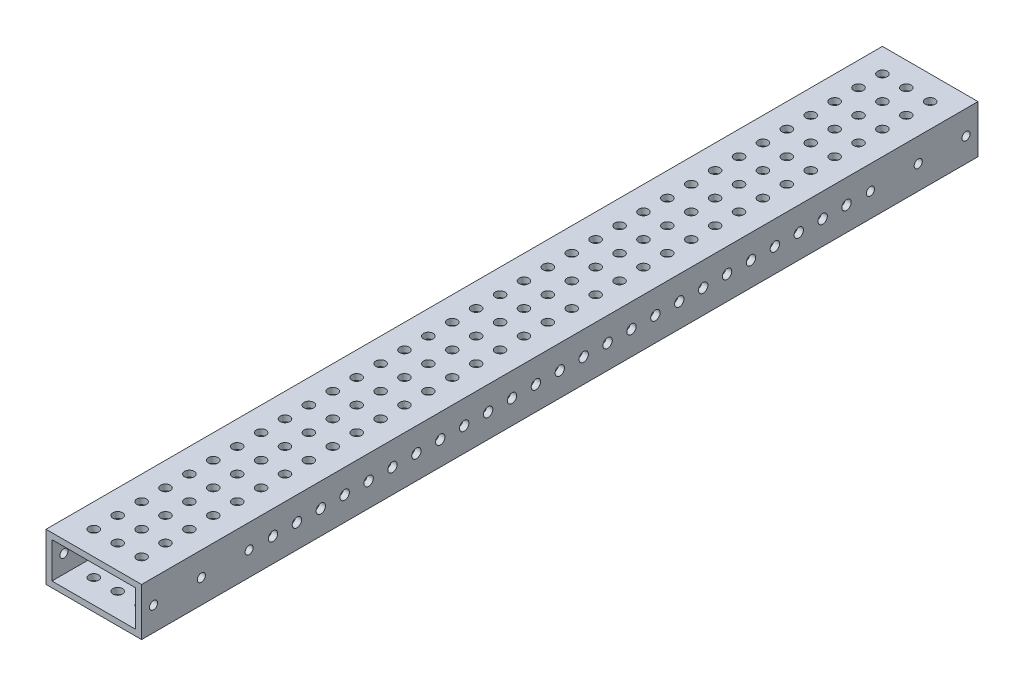
from build123d import *

# Parameters (mm, degrees)
SKETCH1_W           = 50.8
SKETCH1_H           = 25.4
SKETCH1_W_2         = 44.45
SKETCH1_H_2         = 19.05
BOSS_EXTRUDE1_DEPTH = 222.25
SKETCH2_R           = 2.5527
CUT_EXTRUDE1_DEPTH  = 226.134143346
SKETCH3_R           = 2.15265
SKETCH3_R_2         = 2.159
CUT_EXTRUDE2_DEPTH  = 229.335263374
SKETCH4_R           = 2.4892
CUT_EXTRUDE3_DEPTH  = 229.335263374


with BuildPart() as part:
    # Sketch1 → Boss-Extrude1 (new, symmetric)
    with BuildSketch(Plane.XY):
        Rectangle(SKETCH1_W, SKETCH1_H)
        Rectangle(SKETCH1_W_2, SKETCH1_H_2, mode=Mode.SUBTRACT)
    extrude(amount=BOSS_EXTRUDE1_DEPTH, both=True)

    # Sketch2 → Cut-Extrude1 (cut, through all)
    with BuildSketch(Plane(origin=(0, 12.7, 0), x_dir=(1, 0, 0), z_dir=(0, 1, 0))):
        with Locations((0, -209.55)):
            Circle(SKETCH2_R)
        with Locations((12.7, -209.55)):
            Circle(SKETCH2_R)
        with Locations((-12.7, -209.55)):
            Circle(SKETCH2_R)
        with Locations((-12.7, -196.85)):
            Circle(SKETCH2_R)
        with Locations((0, -196.85)):
            Circle(SKETCH2_R)
        with Locations((12.7, -196.85)):
            Circle(SKETCH2_R)
        with Locations((-12.7, -184.15)):
            Circle(SKETCH2_R)
        with Locations((0, -184.15)):
            Circle(SKETCH2_R)
        with Locations((12.7, -184.15)):
            Circle(SKETCH2_R)
        with Locations((-12.7, -171.45)):
            Circle(SKETCH2_R)
        with Locations((0, -171.45)):
            Circle(SKETCH2_R)
        with Locations((12.7, -171.45)):
            Circle(SKETCH2_R)
        with Locations((-12.7, -158.75)):
            Circle(SKETCH2_R)
        with Locations((0, -158.75)):
            Circle(SKETCH2_R)
        with Locations((12.7, -158.75)):
            Circle(SKETCH2_R)
        with Locations((-12.7, -146.05)):
            Circle(SKETCH2_R)
        with Locations((0, -146.05)):
            Circle(SKETCH2_R)
        with Locations((12.7, -146.05)):
            Circle(SKETCH2_R)
        with Locations((-12.7, -133.35)):
            Circle(SKETCH2_R)
        with Locations((0, -133.35)):
            Circle(SKETCH2_R)
        with Locations((12.7, -133.35)):
            Circle(SKETCH2_R)
        with Locations((-12.7, -120.65)):
            Circle(SKETCH2_R)
        with Locations((0, -120.65)):
            Circle(SKETCH2_R)
        with Locations((12.7, -120.65)):
            Circle(SKETCH2_R)
        with Locations((-12.7, -107.95)):
            Circle(SKETCH2_R)
        with Locations((0, -107.95)):
            Circle(SKETCH2_R)
        with Locations((12.7, -107.95)):
            Circle(SKETCH2_R)
        with Locations((-12.7, -95.25)):
            Circle(SKETCH2_R)
        with Locations((0, -95.25)):
            Circle(SKETCH2_R)
        with Locations((12.7, -95.25)):
            Circle(SKETCH2_R)
        with Locations((-12.7, -82.55)):
            Circle(SKETCH2_R)
        with Locations((0, -82.55)):
            Circle(SKETCH2_R)
        with Locations((12.7, -82.55)):
            Circle(SKETCH2_R)
        with Locations((-12.7, -69.85)):
            Circle(SKETCH2_R)
        with Locations((0, -69.85)):
            Circle(SKETCH2_R)
        with Locations((12.7, -69.85)):
            Circle(SKETCH2_R)
        with Locations((-12.7, -57.15)):
            Circle(SKETCH2_R)
        with Locations((0, -57.15)):
            Circle(SKETCH2_R)
        with Locations((12.7, -57.15)):
            Circle(SKETCH2_R)
        with Locations((-12.7, -44.45)):
            Circle(SKETCH2_R)
        with Locations((0, -44.45)):
            Circle(SKETCH2_R)
        with Locations((12.7, -44.45)):
            Circle(SKETCH2_R)
        with Locations((-12.7, -31.75)):
            Circle(SKETCH2_R)
        with Locations((0, -31.75)):
            Circle(SKETCH2_R)
        with Locations((12.7, -31.75)):
            Circle(SKETCH2_R)
        with Locations((-12.7, -19.05)):
            Circle(SKETCH2_R)
        with Locations((0, -19.05)):
            Circle(SKETCH2_R)
        with Locations((12.7, -19.05)):
            Circle(SKETCH2_R)
        with Locations((-12.7, -6.35)):
            Circle(SKETCH2_R)
        with Locations((0, -6.35)):
            Circle(SKETCH2_R)
        with Locations((12.7, -6.35)):
            Circle(SKETCH2_R)
        with Locations((-12.7, 6.35)):
            Circle(SKETCH2_R)
        with Locations((0, 6.35)):
            Circle(SKETCH2_R)
        with Locations((12.7, 6.35)):
            Circle(SKETCH2_R)
        with Locations((-12.7, 19.05)):
            Circle(SKETCH2_R)
        with Locations((0, 19.05)):
            Circle(SKETCH2_R)
        with Locations((12.7, 19.05)):
            Circle(SKETCH2_R)
        with Locations((-12.7, 31.75)):
            Circle(SKETCH2_R)
        with Locations((0, 31.75)):
            Circle(SKETCH2_R)
        with Locations((12.7, 31.75)):
            Circle(SKETCH2_R)
        with Locations((-12.7, 44.45)):
            Circle(SKETCH2_R)
        with Locations((0, 44.45)):
            Circle(SKETCH2_R)
        with Locations((12.7, 44.45)):
            Circle(SKETCH2_R)
        with Locations((-12.7, 57.15)):
            Circle(SKETCH2_R)
        with Locations((0, 57.15)):
            Circle(SKETCH2_R)
        with Locations((12.7, 57.15)):
            Circle(SKETCH2_R)
        with Locations((-12.7, 69.85)):
            Circle(SKETCH2_R)
        with Locations((0, 69.85)):
            Circle(SKETCH2_R)
        with Locations((12.7, 69.85)):
            Circle(SKETCH2_R)
        with Locations((-12.7, 82.55)):
            Circle(SKETCH2_R)
        with Locations((0, 82.55)):
            Circle(SKETCH2_R)
        with Locations((12.7, 82.55)):
            Circle(SKETCH2_R)
        with Locations((-12.7, 95.25)):
            Circle(SKETCH2_R)
        with Locations((0, 95.25)):
            Circle(SKETCH2_R)
        with Locations((12.7, 95.25)):
            Circle(SKETCH2_R)
        with Locations((-12.7, 107.95)):
            Circle(SKETCH2_R)
        with Locations((0, 107.95)):
            Circle(SKETCH2_R)
        with Locations((12.7, 107.95)):
            Circle(SKETCH2_R)
        with Locations((-12.7, 120.65)):
            Circle(SKETCH2_R)
        with Locations((0, 120.65)):
            Circle(SKETCH2_R)
        with Locations((12.7, 120.65)):
            Circle(SKETCH2_R)
        with Locations((-12.7, 133.35)):
            Circle(SKETCH2_R)
        with Locations((0, 133.35)):
            Circle(SKETCH2_R)
        with Locations((12.7, 133.35)):
            Circle(SKETCH2_R)
        with Locations((-12.7, 146.05)):
            Circle(SKETCH2_R)
        with Locations((0, 146.05)):
            Circle(SKETCH2_R)
        with Locations((12.7, 146.05)):
            Circle(SKETCH2_R)
        with Locations((-12.7, 158.75)):
            Circle(SKETCH2_R)
        with Locations((0, 158.75)):
            Circle(SKETCH2_R)
        with Locations((12.7, 158.75)):
            Circle(SKETCH2_R)
        with Locations((-12.7, 171.45)):
            Circle(SKETCH2_R)
        with Locations((0, 171.45)):
            Circle(SKETCH2_R)
        with Locations((12.7, 171.45)):
            Circle(SKETCH2_R)
        with Locations((-12.7, 184.15)):
            Circle(SKETCH2_R)
        with Locations((0, 184.15)):
            Circle(SKETCH2_R)
        with Locations((12.7, 184.15)):
            Circle(SKETCH2_R)
        with Locations((-12.7, 196.85)):
            Circle(SKETCH2_R)
        with Locations((0, 196.85)):
            Circle(SKETCH2_R)
        with Locations((12.7, 196.85)):
            Circle(SKETCH2_R)
        with Locations((-12.7, 209.55)):
            Circle(SKETCH2_R)
        with Locations((0, 209.55)):
            Circle(SKETCH2_R)
        with Locations((12.7, 209.55)):
            Circle(SKETCH2_R)
    extrude(amount=-CUT_EXTRUDE1_DEPTH, mode=Mode.SUBTRACT)

    # Sketch3 → Cut-Extrude2 (cut, through all)
    with BuildSketch(Plane(origin=(25.4, 0, 0), x_dir=(0, 0, -1), z_dir=(1, 0, 0))):
        with Locations((-215.9, 0)):
            Circle(SKETCH3_R)
        with Locations((-190.5, 0)):
            Circle(SKETCH3_R)
        with Locations((-165.1, 0)):
            Circle(SKETCH3_R)
        with Locations((215.9, 0)):
            Circle(SKETCH3_R_2)
        with Locations((190.5, 0)):
            Circle(SKETCH3_R_2)
        with Locations((165.1, 0)):
            Circle(SKETCH3_R_2)
    extrude(amount=-CUT_EXTRUDE2_DEPTH, mode=Mode.SUBTRACT)

    # Sketch4 → Cut-Extrude3 (cut, through all)
    with BuildSketch(Plane(origin=(25.4, 0, 0), x_dir=(0, 0, -1), z_dir=(1, 0, 0))):
        with Locations((-152.4, 0)):
            Circle(SKETCH4_R)
        with Locations((-139.7, 0)):
            Circle(SKETCH4_R)
        with Locations((-127, 0)):
            Circle(SKETCH4_R)
        with Locations((-114.3, 0)):
            Circle(SKETCH4_R)
        with Locations((-101.6, 0)):
            Circle(SKETCH4_R)
        with Locations((-88.9, 0)):
            Circle(SKETCH4_R)
        with Locations((-76.2, 0)):
            Circle(SKETCH4_R)
        with Locations((-63.5, 0)):
            Circle(SKETCH4_R)
        with Locations((-50.8, 0)):
            Circle(SKETCH4_R)
        with Locations((-38.1, 0)):
            Circle(SKETCH4_R)
        with Locations((-25.4, 0)):
            Circle(SKETCH4_R)
        with Locations((-12.7, 0)):
            Circle(SKETCH4_R)
        Circle(SKETCH4_R)
        with Locations((12.7, 0)):
            Circle(SKETCH4_R)
        with Locations((25.4, 0)):
            Circle(SKETCH4_R)
        with Locations((38.1, 0)):
            Circle(SKETCH4_R)
        with Locations((50.8, 0)):
            Circle(SKETCH4_R)
        with Locations((63.5, 0)):
            Circle(SKETCH4_R)
        with Locations((76.2, 0)):
            Circle(SKETCH4_R)
        with Locations((88.9, 0)):
            Circle(SKETCH4_R)
        with Locations((101.6, 0)):
            Circle(SKETCH4_R)
        with Locations((114.3, 0)):
            Circle(SKETCH4_R)
        with Locations((127, 0)):
            Circle(SKETCH4_R)
        with Locations((139.7, 0)):
            Circle(SKETCH4_R)
        with Locations((152.4, 0)):
            Circle(SKETCH4_R)
    extrude(amount=-CUT_EXTRUDE3_DEPTH, mode=Mode.SUBTRACT)


solid = part.part
